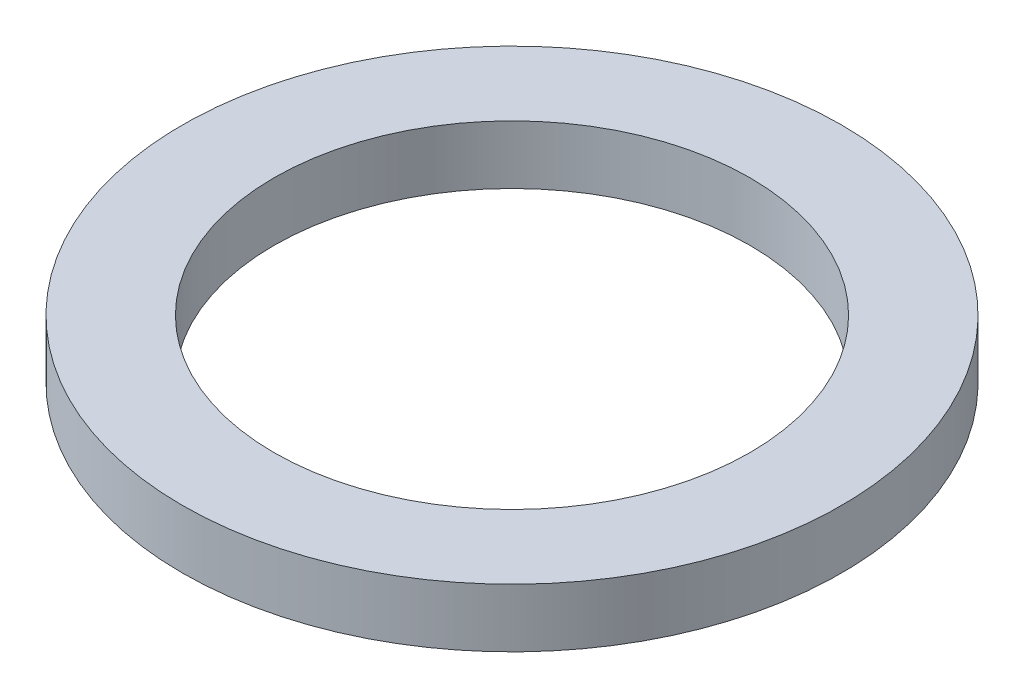
from build123d import *

# Parameters (mm, degrees)
SKETCH1_R           = 45
BOSS_EXTRUDE1_DEPTH = 8
SKETCH2_R           = 32.5
CUT_EXTRUDE1_DEPTH  = 65.140470843


with BuildPart() as part:
    # Sketch1 → Boss-Extrude1 (new body)
    with BuildSketch(Plane(origin=(0, 0, 0), x_dir=(1, 0, 0), z_dir=(0, 1, 0))):
        Circle(SKETCH1_R)
    extrude(amount=BOSS_EXTRUDE1_DEPTH)

    # Sketch2 → Cut-Extrude1 (cut, through all)
    with BuildSketch(Plane(origin=(0, 0, 0), x_dir=(1, 0, 0), z_dir=(0, 1, 0))):
        Circle(SKETCH2_R)
    extrude(amount=CUT_EXTRUDE1_DEPTH, mode=Mode.SUBTRACT)


solid = part.part
